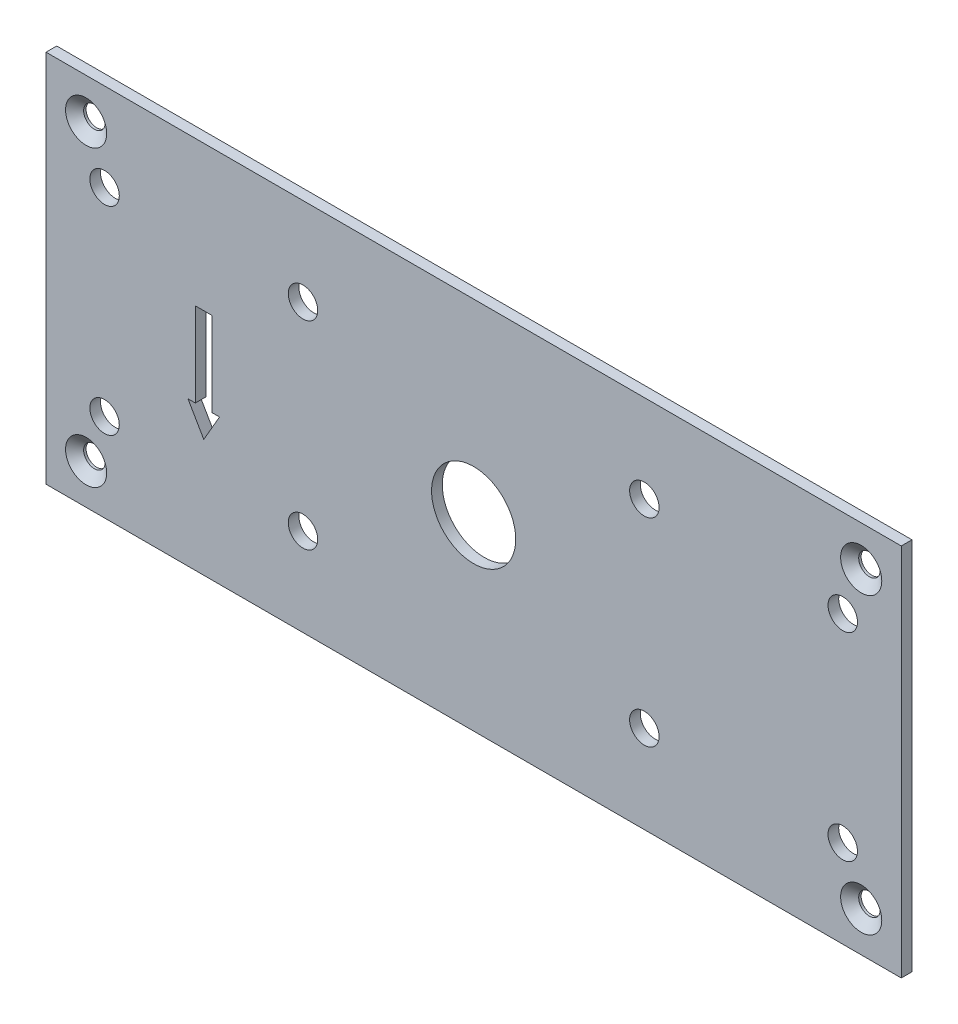
from build123d import *

# Parameters (mm, degrees)
SKETCH2_W                                  = 203.2
SKETCH2_H                                  = 88.9
SKETCH2_R                                  = 3.5
SKETCH2_R_2                                = 10
BOSS_EXTRUDE1_DEPTH                        = 1.27
SKETCH3_R                                  = 2.5527
CUT_EXTRUDE1_DEPTH                         = 111.92706658
CUT_EXTRUDE2_DEPTH                         = 111.92706658
CUT_EXTRUDE2_DEPTH_BACK                    = 111.92706658
CSK_FOR_10_FLAT_HEAD_MACHINE_SCREW_2_COUNT = 2
CSK_FOR_10_FLAT_HEAD_MACHINE_SCREW_2_PITCH = 69.85
CSK_FOR_10_FLAT_HEAD_MACHINE_SCREW_3_COUNT = 2
CSK_FOR_10_FLAT_HEAD_MACHINE_SCREW_3_PITCH = 196.952392725
CSK_FOR_10_FLAT_HEAD_MACHINE_SCREW_4_COUNT = 2
CSK_FOR_10_FLAT_HEAD_MACHINE_SCREW_4_PITCH = 184.15


with BuildPart() as part:
    # Sketch2 → Boss-Extrude1 (new, symmetric)
    with BuildSketch(Plane.XY):
        Rectangle(SKETCH2_W, SKETCH2_H)
        with Locations((-87.695, 23.57)):
            Circle(SKETCH2_R, mode=Mode.SUBTRACT)
        with Locations((-40.555, 23.57)):
            Circle(SKETCH2_R, mode=Mode.SUBTRACT)
        with Locations((-40.555, -23.57)):
            Circle(SKETCH2_R, mode=Mode.SUBTRACT)
        with Locations((-87.695, -23.57)):
            Circle(SKETCH2_R, mode=Mode.SUBTRACT)
        with Locations((40.555, -23.57)):
            Circle(SKETCH2_R, mode=Mode.SUBTRACT)
        with Locations((87.695, -23.57)):
            Circle(SKETCH2_R, mode=Mode.SUBTRACT)
        with Locations((87.695, 23.57)):
            Circle(SKETCH2_R, mode=Mode.SUBTRACT)
        with Locations((40.555, 23.57)):
            Circle(SKETCH2_R, mode=Mode.SUBTRACT)
        Circle(SKETCH2_R_2, mode=Mode.SUBTRACT)
    extrude(amount=BOSS_EXTRUDE1_DEPTH, both=True)

    # Sketch3 → Cut-Extrude1 (cut, through all)
    with BuildSketch(Plane.XY.offset(1.27)):
        with Locations((-92.075, 34.925)):
            Circle(SKETCH3_R)
        with Locations((-92.075, -34.925)):
            Circle(SKETCH3_R)
        with Locations((92.075, -34.925)):
            Circle(SKETCH3_R)
        with Locations((92.075, 34.925)):
            Circle(SKETCH3_R)
    extrude(amount=-CUT_EXTRUDE1_DEPTH, mode=Mode.SUBTRACT)

    # Sketch4 → Cut-Extrude2 (cut, two sides: drawn at the far end of the back side and taken through both)
    with BuildSketch(Plane.XY.offset(1.27).offset(-CUT_EXTRUDE2_DEPTH_BACK)):
        Polygon((-60.375348502, -10), (-62.125, -10), (-62.125, 10), (-66.125, 10), (-66.125, -10), (-67.874651498, -10), (-64.125, -16.494586906), align=None)
    extrude(amount=CUT_EXTRUDE2_DEPTH + CUT_EXTRUDE2_DEPTH_BACK, mode=Mode.SUBTRACT)

    # Sketch6 → CSK for #10 Flat Head Machine Screw (100)1 (revolve, cut)
    with BuildSketch(Plane(origin=(-92.075, 34.925, 1.27), x_dir=(0, -1, 0), z_dir=(1, 0, 0))):
        Polygon((0, 0), (0, 2.54), (2.5527, 2.54), (2.5527, 1.960808018), (4.8895, 0), align=None)
    csk_for_10_flat_head_machine_screw_100 = revolve(axis=Axis((-92.075, 34.925, 7.62), (0, 0, -1)), mode=Mode.SUBTRACT)

    # CSK for _10 Flat Head Machine Screw  2: CSK for #10 Flat Head Machine Screw (100)1 ×2
    with Locations(*[(0, -i * CSK_FOR_10_FLAT_HEAD_MACHINE_SCREW_2_PITCH, 0) for i in range(1, CSK_FOR_10_FLAT_HEAD_MACHINE_SCREW_2_COUNT)]):
        add(csk_for_10_flat_head_machine_screw_100, mode=Mode.SUBTRACT)

    # CSK for _10 Flat Head Machine Screw  3: CSK for #10 Flat Head Machine Screw (100)1 ×2
    with Locations(*[Vector(0.9349975263177835, -0.35465423412053854, 0) * (i * CSK_FOR_10_FLAT_HEAD_MACHINE_SCREW_3_PITCH) for i in range(1, CSK_FOR_10_FLAT_HEAD_MACHINE_SCREW_3_COUNT)]):
        add(csk_for_10_flat_head_machine_screw_100, mode=Mode.SUBTRACT)

    # CSK for _10 Flat Head Machine Screw  4: CSK for #10 Flat Head Machine Screw (100)1 ×2
    with Locations(*[(i * CSK_FOR_10_FLAT_HEAD_MACHINE_SCREW_4_PITCH, 0, 0) for i in range(1, CSK_FOR_10_FLAT_HEAD_MACHINE_SCREW_4_COUNT)]):
        add(csk_for_10_flat_head_machine_screw_100, mode=Mode.SUBTRACT)


solid = part.part
